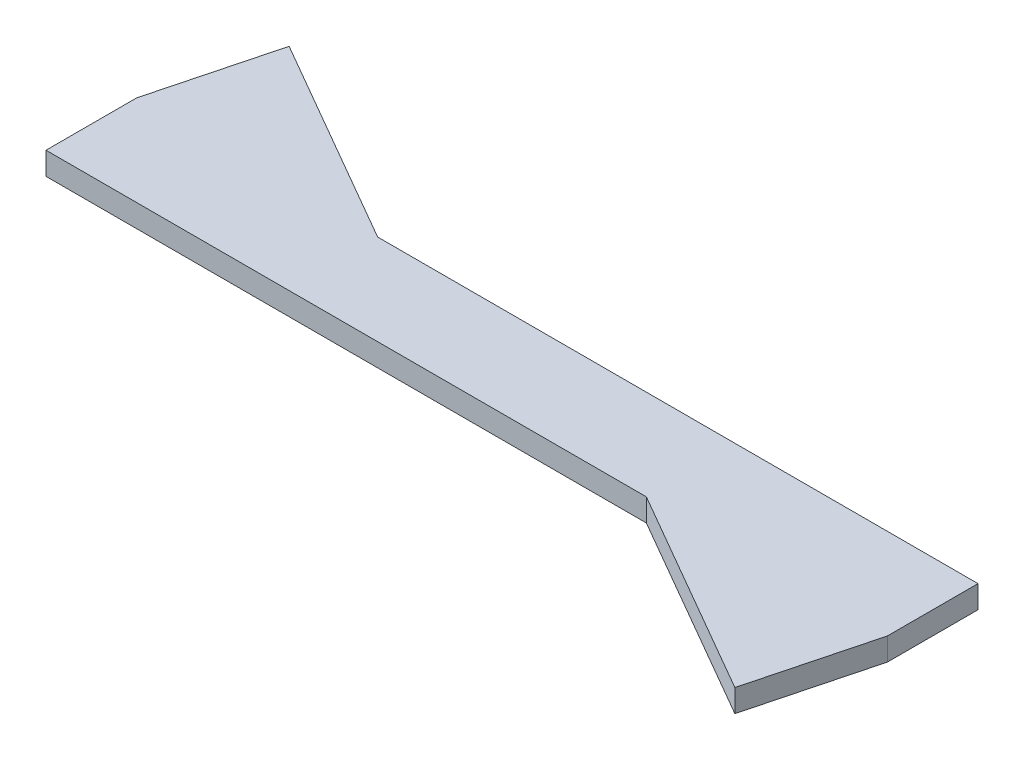
from build123d import *

# Parameters (mm, degrees)
BOSS_EXTRUDE2_DEPTH = 4.7625


with BuildPart() as part:
    # Sketch1 → Boss-Extrude2 (new body)
    with BuildSketch(Plane(origin=(0, 0, 0), x_dir=(1, 0, 0), z_dir=(0, 1, 0))):
        Polygon((88.38825926, 9.525), (-37.758306242, 9.525), (-81.752396754, 34.925), (-88.38825926, 9.525), (-88.38825926, -9.525), (37.758306242, -9.525), (81.752396754, -34.925), (88.38825926, -9.525), align=None)
    extrude(amount=BOSS_EXTRUDE2_DEPTH)


solid = part.part
